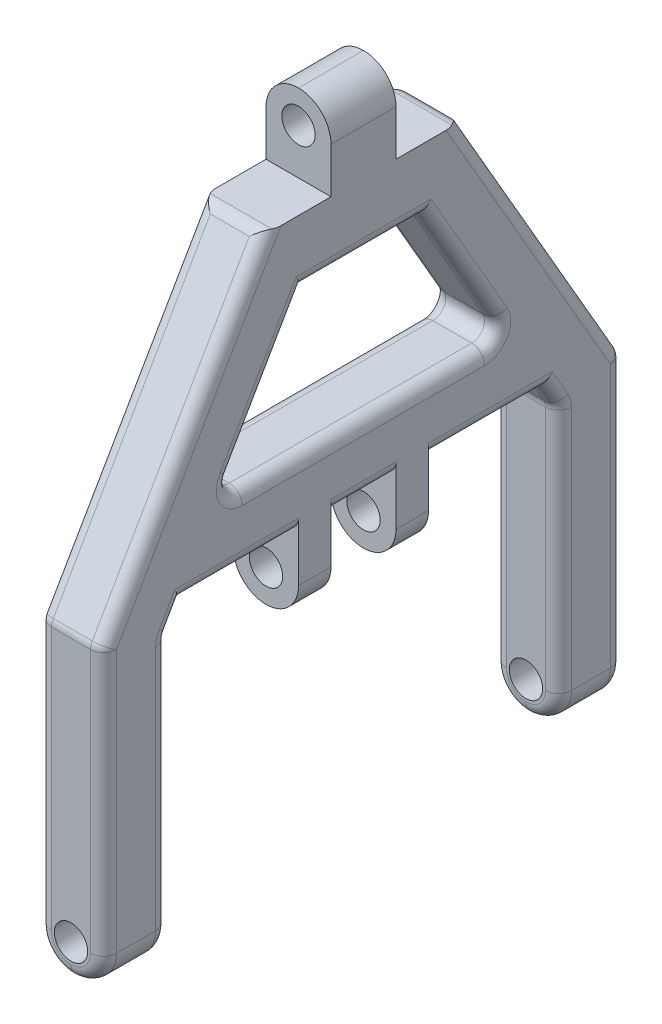
from build123d import *

# Parameters (mm, degrees)
BOSS_EXTRUDE1_DEPTH = 3.175
SKETCH4_W           = 6.35
SKETCH4_H           = 3.175
BOSS_EXTRUDE3_DEPTH = 7.62
FILLET2_R           = 1.27
SKETCH8_W           = 6.35
SKETCH8_H           = 6.35
BOSS_EXTRUDE5_DEPTH = 7.62
SKETCH7_R           = 1.627
CUT_EXTRUDE3_DEPTH  = 63.5
FILLET3_R           = 3.175
SKETCH9_R           = 1.627
CUT_EXTRUDE4_DEPTH  = 6.35
CUT_EXTRUDE5_REACH  = 70.976
SKETCH10_R          = 1.627


with BuildPart() as part:
    # Sketch2 → Boss-Extrude1 (new, symmetric)
    with BuildSketch(Plane(origin=(0, 0, 0), x_dir=(0, 0, -1), z_dir=(1, 0, 0))):
        Polygon((-25.4, 26.035), (-25.4, 3.175), (-25.4, -3.175), (-19.05, -3.175), (-19.05, 3.175), (-19.05, 9.525), (-19.05, 24.333522628), (-17.708087105, 26.657783942), (17.708087105, 26.657783942), (19.05, 24.333522628), (19.05, 3.175), (19.05, -3.175), (25.4, -3.175), (25.4, 3.175), (25.4, 26.035), (9.525, 53.53130657), (0, 53.53130657), (-9.525, 53.53130657), align=None)
        Polygon((-14.041912895, 33.007783942), (-5.858825791, 47.18130657), (0, 47.18130657), (5.858825791, 47.18130657), (14.041912895, 33.007783942), align=None, mode=Mode.SUBTRACT)
    extrude(amount=BOSS_EXTRUDE1_DEPTH, both=True)

    # Sketch4 → Boss-Extrude3 (add)
    with BuildSketch(Plane.XZ.offset(-26.657783942)):
        with Locations((0, -4.7625)):
            Rectangle(SKETCH4_W, SKETCH4_H)
        with Locations((0, 4.7625)):
            Rectangle(SKETCH4_W, SKETCH4_H)
    extrude(amount=BOSS_EXTRUDE3_DEPTH)

    # Fillet2
    fillet2_edges = [part.edges().sort_by_distance(p)[0] for p in [
        (3.175, 40.094545256, -9.950369343),
        (3.175, 33.007783942, 0),
        (-3.175, 26.657783942, -12.029043552),
        (-3.175, 25.495653285, 18.379043552),
        (-3.175, 10.579261314, 19.05),
        (-3.175, 11.43, 25.4),
        (-3.175, 39.783153285, 17.4625),
        (-3.175, 39.783153285, -17.4625),
        (3.175, 40.094545256, 9.950369343),
        (-3.175, 11.43, -25.4),
        (-3.175, 10.579261314, -19.05),
        (-3.175, 25.495653285, -18.379043552),
        (-3.175, 40.094545256, 9.950369343),
        (-3.175, 33.007783942, 0),
        (-3.175, 40.094545256, -9.950369343),
        (-3.175, 47.18130657, 0),
        (3.175, 25.495653285, -18.379043552),
        (0, 24.333522628, 19.05),
        (0, -3.175, 19.05),
        (3.175, 10.579261314, -19.05),
        (0, -3.175, 25.4),
        (0, 26.035, 25.4),
        (0, 53.53130657, 9.525),
        (0, 53.53130657, -9.525),
        (0, 26.035, -25.4),
        (0, -3.175, -25.4),
        (0, -3.175, -19.05),
        (0, 24.333522628, -19.05),
        (0, 33.007783942, 14.041912895),
        (0, 33.007783942, -14.041912895),
        (3.175, 11.43, -25.4),
        (3.175, 39.783153285, -17.4625),
        (-3.175, 26.657783942, 12.029043552),
        (3.175, 26.657783942, 12.029043552),
        (3.175, 39.783153285, 17.4625),
        (3.175, 11.43, 25.4),
        (-3.175, 26.657783942, 0),
        (3.175, 26.657783942, 0),
        (3.175, 47.18130657, 0),
        (3.175, 10.579261314, 19.05),
        (3.175, 25.495653285, 18.379043552),
        (3.175, 26.657783942, -12.029043552),
    ]]
    fillet(fillet2_edges, radius=FILLET2_R)

    # Sketch8 → Boss-Extrude5 (add)
    with BuildSketch(Plane(origin=(0, 53.53130657, 0), x_dir=(1, 0, 0), z_dir=(0, 1, 0))):
        Rectangle(SKETCH8_W, SKETCH8_H)
    extrude(amount=BOSS_EXTRUDE5_DEPTH)

    # Sketch7 → Cut-Extrude3 (cut)
    with BuildSketch(Plane(origin=(0, 0, -25.4), x_dir=(-1, 0, 0), z_dir=(0, 0, -1))):
        Circle(SKETCH7_R)
    extrude(amount=-CUT_EXTRUDE3_DEPTH, mode=Mode.SUBTRACT)

    # Fillet3
    # the kernel refuses this fillet: 3.175 mm, written as the material it takes off along each edge
    with BuildSketch(Plane(origin=(0, 0, 25.4), x_dir=(0, -1, 0), z_dir=(-1, 0, 0))) as fillet3_piece_1:
        with BuildLine():
            CenterArc((1.905, -1.27), 1.27, 0, 90)
            Line((3.175, -1.27), (3.175, 0))
            Line((3.175, 0), (1.905, 0))
        make_face()
    revolve(axis=Axis((0, 0, 25.4), (0, 0, 1)), revolution_arc=90, mode=Mode.SUBTRACT)
    with BuildSketch(Plane(origin=(0, 0, 19.05), x_dir=(1, 0, 0), z_dir=(0, 1, 0))) as fillet3_piece_2:
        with BuildLine():
            CenterArc((1.905, -1.27), 1.27, 0, 90)
            Line((3.175, -1.27), (3.175, 0))
            Line((3.175, 0), (1.905, 0))
        make_face()
    revolve(axis=Axis((0, 0, 19.05), (0, 0, -1)), revolution_arc=90, mode=Mode.SUBTRACT)
    with BuildSketch(Plane(origin=(0, 0, 25.4), x_dir=(-1, 0, 0), z_dir=(0, 1, 0))) as fillet3_piece_3:
        with BuildLine():
            CenterArc((1.905, -1.27), 1.27, 0, 90)
            Line((3.175, -1.27), (3.175, 0))
            Line((3.175, 0), (1.905, 0))
        make_face()
    revolve(axis=Axis((0, 0, 25.4), (0, 0, 1)), revolution_arc=90, mode=Mode.SUBTRACT)
    with BuildSketch(Plane(origin=(0, 0, 19.05), x_dir=(0, -1, 0), z_dir=(1, 0, 0))) as fillet3_piece_4:
        with BuildLine():
            CenterArc((1.905, -1.27), 1.27, 0, 90)
            Line((3.175, -1.27), (3.175, 0))
            Line((3.175, 0), (1.905, 0))
        make_face()
    revolve(axis=Axis((0, 0, 19.05), (0, 0, -1)), revolution_arc=90, mode=Mode.SUBTRACT)
    with BuildSketch(Plane(origin=(0, 0, -25.4), x_dir=(1, 0, 0), z_dir=(0, 1, 0))) as fillet3_piece_5:
        with BuildLine():
            CenterArc((1.905, -1.27), 1.27, 0, 90)
            Line((3.175, -1.27), (3.175, 0))
            Line((3.175, 0), (1.905, 0))
        make_face()
    revolve(axis=Axis((0, 0, -25.4), (0, 0, -1)), revolution_arc=90, mode=Mode.SUBTRACT)
    with BuildSketch(Plane(origin=(0, 0, -25.4), x_dir=(0, -1, 0), z_dir=(1, 0, 0))) as fillet3_piece_6:
        with BuildLine():
            CenterArc((1.905, -1.27), 1.27, 0, 90)
            Line((3.175, -1.27), (3.175, 0))
            Line((3.175, 0), (1.905, 0))
        make_face()
    revolve(axis=Axis((0, 0, -25.4), (0, 0, -1)), revolution_arc=90, mode=Mode.SUBTRACT)
    with BuildSketch(Plane(origin=(0, 0, -19.05), x_dir=(0, -1, 0), z_dir=(-1, 0, 0))) as fillet3_piece_7:
        with BuildLine():
            CenterArc((1.905, -1.27), 1.27, 0, 90)
            Line((3.175, -1.27), (3.175, 0))
            Line((3.175, 0), (1.905, 0))
        make_face()
    revolve(axis=Axis((0, 0, -19.05), (0, 0, 1)), revolution_arc=90, mode=Mode.SUBTRACT)
    with BuildSketch(Plane(origin=(0, 0, -19.05), x_dir=(-1, 0, 0), z_dir=(0, 1, 0))) as fillet3_piece_8:
        with BuildLine():
            CenterArc((1.905, -1.27), 1.27, 0, 90)
            Line((3.175, -1.27), (3.175, 0))
            Line((3.175, 0), (1.905, 0))
        make_face()
    revolve(axis=Axis((0, 0, -19.05), (0, 0, 1)), revolution_arc=90, mode=Mode.SUBTRACT)
    with BuildSketch(Plane(origin=(-3.175, 19.037783942, -4.7625), x_dir=(0, 1, 0), z_dir=(0, 0, 1)), Plane(origin=(3.175, 19.037783942, 14.2875), x_dir=(0, 1, 0), z_dir=(0, 0, -1))) as fillet3_piece_9:
        with BuildLine():
            CenterArc((FILLET3_R, -FILLET3_R), FILLET3_R, 90, 90)
            Line((0, -FILLET3_R), (0, 0))
            Line((0, 0), (FILLET3_R, 0))
        make_face()
    extrude(amount=19.05, mode=Mode.SUBTRACT)
    with BuildSketch(Plane(origin=(-3.175, 19.037783942, 4.7625), x_dir=(0, 1, 0), z_dir=(0, 0, -1)), Plane(origin=(3.175, 19.037783942, -14.2875), x_dir=(0, 1, 0), z_dir=(0, 0, 1))) as fillet3_piece_10:
        with BuildLine():
            CenterArc((FILLET3_R, FILLET3_R), FILLET3_R, 180, 90)
            Line((0, FILLET3_R), (0, 0))
            Line((0, 0), (FILLET3_R, 0))
        make_face()
    extrude(amount=19.05, mode=Mode.SUBTRACT)
    with BuildSketch(Plane(origin=(-3.175, 61.15130657, 11.1125), x_dir=(0, -1, 0), z_dir=(0, 0, -1)), Plane(origin=(3.175, 61.15130657, -11.1125), x_dir=(0, -1, 0), z_dir=(0, 0, 1))) as fillet3_piece_11:
        with BuildLine():
            CenterArc((FILLET3_R, -FILLET3_R), FILLET3_R, 90, 90)
            Line((0, -FILLET3_R), (0, 0))
            Line((0, 0), (FILLET3_R, 0))
        make_face()
    extrude(amount=22.225, mode=Mode.SUBTRACT)
    with BuildSketch(Plane(origin=(-3.175, -3.175, 25.4), x_dir=(0, 1, 0), z_dir=(0, 0, -1)), Plane(origin=(-3.175, -3.175, -19.05), x_dir=(0, 1, 0), z_dir=(0, 0, -1))) as fillet3_piece_12:
        with BuildLine():
            CenterArc((FILLET3_R, FILLET3_R), FILLET3_R, 180, 90)
            Line((0, FILLET3_R), (0, 0))
            Line((0, 0), (FILLET3_R, 0))
        make_face()
    extrude(amount=6.35, mode=Mode.SUBTRACT)
    with BuildSketch(Plane(origin=(3.175, -3.175, 25.4), x_dir=(0, 1, 0), z_dir=(0, 0, -1)), Plane(origin=(3.175, -3.175, -19.05), x_dir=(0, 1, 0), z_dir=(0, 0, -1))) as fillet3_piece_13:
        with BuildLine():
            CenterArc((FILLET3_R, -FILLET3_R), FILLET3_R, 90, 90)
            Line((0, -FILLET3_R), (0, 0))
            Line((0, 0), (FILLET3_R, 0))
        make_face()
    extrude(amount=6.35, mode=Mode.SUBTRACT)

    # Sketch9 → Cut-Extrude4 (cut)
    with BuildSketch(Plane.XY.offset(3.175)):
        with Locations((0, 57.97630657)):
            Circle(SKETCH9_R)
    extrude(amount=-CUT_EXTRUDE4_DEPTH, mode=Mode.SUBTRACT)

    # Cut-Extrude5: up to this face of the body (flat: up to its plane)
    cut_extrude5_end = Plane(part.part.faces().sort_by_distance((0, 23.210890681, -6.35))[0])
    # Sketch10 → Cut-Extrude5 (cut, up to the picked face)
    with BuildSketch(Plane.XY.offset(6.35), mode=Mode.PRIVATE) as cut_extrude5_sk1:
        with Locations((0, 22.212783942)):
            Circle(SKETCH10_R)
    cut_extrude5_tool1 = split(extrude(cut_extrude5_sk1.sketch, amount=-CUT_EXTRUDE5_REACH, mode=Mode.PRIVATE), bisect_by=cut_extrude5_end, keep=Keep.BOTH, mode=Mode.PRIVATE)
    add(cut_extrude5_tool1.solids().sort_by(Axis((0, 22.212784, 6.35), (0, 0, -1)))[0], mode=Mode.SUBTRACT)


solid = part.part
